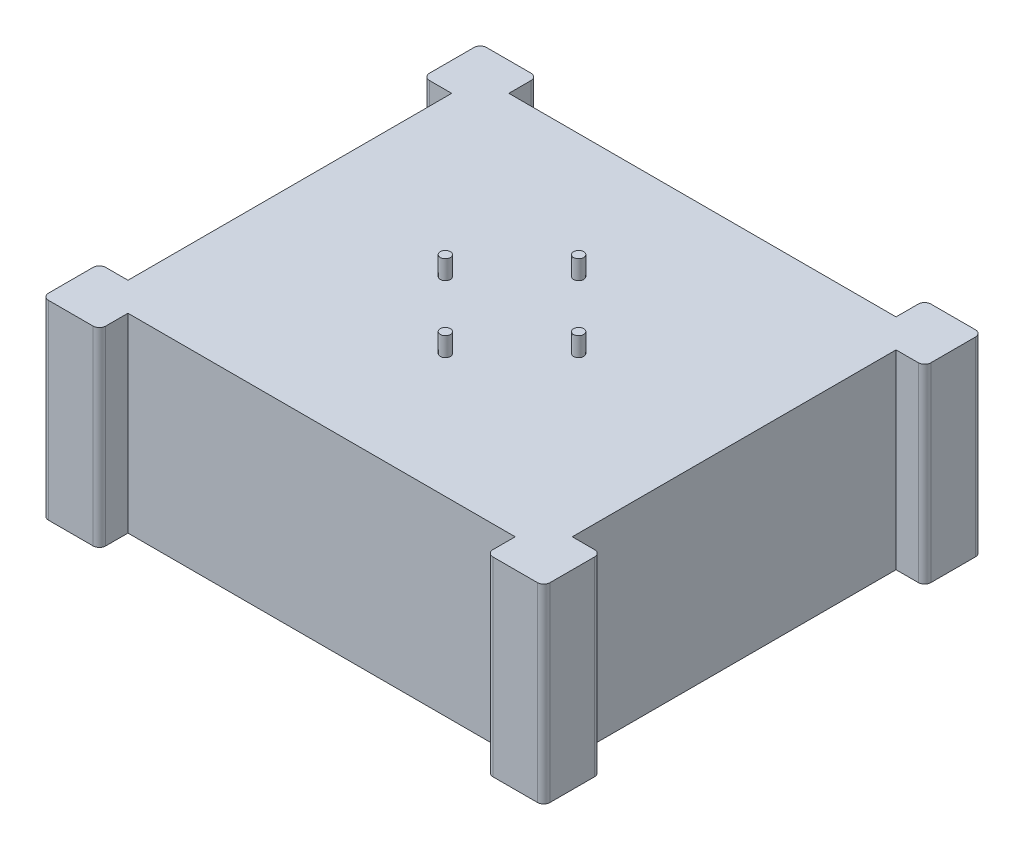
from build123d import *

# Parameters (mm, degrees)
SKETCH1_W           = 350
SKETCH1_H           = 300
BOSS_EXTRUDE1_DEPTH = 3
SKETCH1_3_R         = 4
BOSS_EXTRUDE2_DEPTH = 15
BOSS_EXTRUDE3_DEPTH = 150
CUT_EXTRUDE1_DEPTH  = 150


with BuildPart() as part:
    # Sketch1 → Boss-Extrude1 (new body)
    with BuildSketch(Plane(origin=(0, 0, 0), x_dir=(1, 0, 0), z_dir=(0, 1, 0))):
        Rectangle(SKETCH1_W, SKETCH1_H)
    extrude(amount=-BOSS_EXTRUDE1_DEPTH)

    # Sketch1<3> → Boss-Extrude2 (add)
    with BuildSketch(Plane(origin=(0, 0, 0), x_dir=(1, 0, 0), z_dir=(0, 1, 0))):
        with Locations((0, 52.5)):
            Circle(SKETCH1_3_R)
        with Locations((0, -52.5)):
            Circle(SKETCH1_3_R)
        with Locations((52.5, 0)):
            Circle(SKETCH1_3_R)
        with Locations((-52.5, 0)):
            Circle(SKETCH1_3_R)
    extrude(amount=BOSS_EXTRUDE2_DEPTH)

    # Sketch1<4> → Boss-Extrude3 (add)
    with BuildSketch(Plane(origin=(0, 0, 0), x_dir=(1, 0, 0), z_dir=(0, 1, 0))):
        with BuildLine():
            Line((-192.5, 127.5), (-175, 127.5))
            Line((-175, 127.5), (-175, -127.5))
            Line((-175, -127.5), (-192.5, -127.5))
            ThreePointArc((-192.5, -127.5), (-196.035533906, -128.964466094), (-197.5, -132.5))
            Line((-197.5, -132.5), (-197.5, -167.5))
            ThreePointArc((-197.5, -167.5), (-196.035533906, -171.035533906), (-192.5, -172.5))
            Line((-192.5, -172.5), (-157.5, -172.5))
            ThreePointArc((-157.5, -172.5), (-153.964466094, -171.035533906), (-152.5, -167.5))
            Line((-152.5, -167.5), (-152.5, -150))
            Line((-152.5, -150), (152.5, -150))
            Line((152.5, -150), (152.5, -167.5))
            ThreePointArc((152.5, -167.5), (153.964466094, -171.035533906), (157.5, -172.5))
            Line((157.5, -172.5), (192.5, -172.5))
            ThreePointArc((192.5, -172.5), (196.035533906, -171.035533906), (197.5, -167.5))
            Line((197.5, -167.5), (197.5, -132.5))
            ThreePointArc((197.5, -132.5), (196.035533906, -128.964466094), (192.5, -127.5))
            Line((192.5, -127.5), (175, -127.5))
            Line((175, -127.5), (175, 127.5))
            Line((175, 127.5), (192.5, 127.5))
            ThreePointArc((192.5, 127.5), (196.035533906, 128.964466094), (197.5, 132.5))
            Line((197.5, 132.5), (197.5, 167.5))
            ThreePointArc((197.5, 167.5), (196.035533906, 171.035533906), (192.5, 172.5))
            Line((192.5, 172.5), (157.5, 172.5))
            ThreePointArc((157.5, 172.5), (153.964466094, 171.035533906), (152.5, 167.5))
            Line((152.5, 167.5), (152.5, 150))
            Line((152.5, 150), (-152.5, 150))
            Line((-152.5, 150), (-152.5, 167.5))
            ThreePointArc((-152.5, 167.5), (-153.964466094, 171.035533906), (-157.5, 172.5))
            Line((-157.5, 172.5), (-192.5, 172.5))
            ThreePointArc((-192.5, 172.5), (-196.035533906, 171.035533906), (-197.5, 167.5))
            Line((-197.5, 167.5), (-197.5, 132.5))
            ThreePointArc((-197.5, 132.5), (-196.035533906, 128.964466094), (-192.5, 127.5))
        make_face()
        with BuildLine():
            Line((-170, -127.5), (-170, 127.5))
            Line((-170, 127.5), (-157.5, 127.5))
            ThreePointArc((-157.5, 127.5), (-153.964466094, 128.964466094), (-152.5, 132.5))
            Line((-152.5, 132.5), (-152.5, 145))
            Line((-152.5, 145), (152.5, 145))
            Line((152.5, 145), (152.5, 132.5))
            ThreePointArc((152.5, 132.5), (153.964466094, 128.964466094), (157.5, 127.5))
            Line((157.5, 127.5), (170, 127.5))
            Line((170, 127.5), (170, -127.5))
            Line((170, -127.5), (157.5, -127.5))
            ThreePointArc((157.5, -127.5), (153.964466094, -128.964466094), (152.5, -132.5))
            Line((152.5, -132.5), (152.5, -145))
            Line((152.5, -145), (-152.5, -145))
            Line((-152.5, -145), (-152.5, -132.5))
            ThreePointArc((-152.5, -132.5), (-153.964466094, -128.964466094), (-157.5, -127.5))
            Line((-157.5, -127.5), (-170, -127.5))
        make_face(mode=Mode.SUBTRACT)
    extrude(amount=-BOSS_EXTRUDE3_DEPTH)

    # Sketch3 → Cut-Extrude1 (cut)
    with BuildSketch(Plane.ZY.offset(175)):
        with BuildLine():
            ThreePointArc((-60.172318038, -44.772481883), (-74.423265007, -49.065117798), (-85.266270244, -59.260481944))
            Line((-85.266270244, -59.260481944), (-81.360570452, -61.515438771))
            ThreePointArc((-81.360570452, -61.515438771), (-72.173265007, -52.962232115), (-60.172318038, -49.282395536))
            Line((-60.172318038, -49.282395536), (-60.172318038, -44.772481883))
        make_face()
        with BuildLine():
            Line((-83.359623482, -64.977900186), (-87.265323275, -62.72294336))
            ThreePointArc((-87.265323275, -62.72294336), (-90.673265007, -77.210943421), (-87.265323275, -91.698943483))
            Line((-87.265323275, -91.698943483), (-83.359623482, -89.443986656))
            ThreePointArc((-83.359623482, -89.443986656), (-86.173265007, -77.210943421), (-83.359623482, -64.977900186))
        make_face()
        with BuildLine():
            ThreePointArc((-60.172318038, -52.290995849), (-70.673265007, -55.560308327), (-78.75504615, -63.019738928))
            Line((-78.75504615, -63.019738928), (-70.048241987, -68.046614655))
            ThreePointArc((-70.048241987, -68.046614655), (-65.673265007, -64.220562364), (-60.172318038, -62.344747304))
            Line((-60.172318038, -62.344747304), (-60.172318038, -52.290995849))
        make_face()
        with BuildLine():
            ThreePointArc((-31.080259771, -59.260481944), (-41.923265007, -49.065117798), (-56.174211977, -44.772481883))
            Line((-56.174211977, -44.772481883), (-56.174211977, -49.282395536))
            ThreePointArc((-56.174211977, -49.282395536), (-44.173265007, -52.962232115), (-34.985959563, -61.515438771))
            Line((-34.985959563, -61.515438771), (-31.080259771, -59.260481944))
        make_face()
        with BuildLine():
            Line((-72.047295017, -71.50907607), (-80.754099181, -66.482200343))
            ThreePointArc((-80.754099181, -66.482200343), (-83.173265007, -77.210943421), (-80.754099181, -87.939686499))
            Line((-80.754099181, -87.939686499), (-72.047295017, -82.912810772))
            ThreePointArc((-72.047295017, -82.912810772), (-73.173265007, -77.210943421), (-72.047295017, -71.50907607))
        make_face()
        with BuildLine():
            Line((-81.360570452, -92.906448072), (-85.266270244, -95.161404898))
            ThreePointArc((-85.266270244, -95.161404898), (-74.423265007, -105.356769044), (-60.172318038, -109.64940496))
            Line((-60.172318038, -109.64940496), (-60.172318038, -105.139491306))
            ThreePointArc((-60.172318038, -105.139491306), (-72.173265007, -101.459654727), (-81.360570452, -92.906448072))
        make_face()
        with BuildLine():
            ThreePointArc((-60.172318038, -65.378623827), (-64.173265007, -66.818638576), (-67.420827847, -69.563552916))
            Line((-67.420827847, -69.563552916), (-61.142723279, -73.188218278))
            ThreePointArc((-61.142723279, -73.188218278), (-60.673265007, -72.880816402), (-60.172318038, -72.627954551))
            Line((-60.172318038, -72.627954551), (-60.172318038, -65.378623827))
        make_face()
        with BuildLine():
            ThreePointArc((-37.591483864, -63.019738928), (-45.673265007, -55.560308327), (-56.174211977, -52.290995849))
            Line((-56.174211977, -52.290995849), (-56.174211977, -62.344747304))
            ThreePointArc((-56.174211977, -62.344747304), (-50.673265007, -64.220562364), (-46.298288028, -68.046614655))
            Line((-46.298288028, -68.046614655), (-37.591483864, -63.019738928))
        make_face()
        with BuildLine():
            ThreePointArc((-29.08120674, -91.698943483), (-25.673265007, -77.210943421), (-29.08120674, -62.72294336))
            Line((-29.08120674, -62.72294336), (-32.986906533, -64.977900186))
            ThreePointArc((-32.986906533, -64.977900186), (-30.173265007, -77.210943421), (-32.986906533, -89.443986656))
            Line((-32.986906533, -89.443986656), (-29.08120674, -91.698943483))
        make_face()
        with BuildLine():
            Line((-63.141776309, -76.650679694), (-69.419880877, -73.026014332))
            ThreePointArc((-69.419880877, -73.026014332), (-70.173265007, -77.210943421), (-69.419880877, -81.395872511))
            Line((-69.419880877, -81.395872511), (-63.141776309, -77.771207148))
            ThreePointArc((-63.141776309, -77.771207148), (-63.173265007, -77.210943421), (-63.141776309, -76.650679694))
        make_face()
        with BuildLine():
            Line((-70.048241987, -86.375272187), (-78.75504615, -91.402147915))
            ThreePointArc((-78.75504615, -91.402147915), (-70.673265007, -98.861578516), (-60.172318038, -102.130890993))
            Line((-60.172318038, -102.130890993), (-60.172318038, -92.077139538))
            ThreePointArc((-60.172318038, -92.077139538), (-65.673265007, -90.201324478), (-70.048241987, -86.375272187))
        make_face()
        with BuildLine():
            Line((-56.174211977, -105.139491306), (-56.174211977, -109.64940496))
            ThreePointArc((-56.174211977, -109.64940496), (-41.923265007, -105.356769044), (-31.080259771, -95.161404898))
            Line((-31.080259771, -95.161404898), (-34.985959563, -92.906448072))
            ThreePointArc((-34.985959563, -92.906448072), (-44.173265007, -101.459654727), (-56.174211977, -105.139491306))
        make_face()
        with BuildLine():
            ThreePointArc((-48.925702168, -69.563552916), (-52.173265007, -66.818638576), (-56.174211977, -65.378623827))
            Line((-56.174211977, -65.378623827), (-56.174211977, -72.627954551))
            ThreePointArc((-56.174211977, -72.627954551), (-55.673265007, -72.880816402), (-55.203806736, -73.188218278))
            Line((-55.203806736, -73.188218278), (-48.925702168, -69.563552916))
        make_face()
        with BuildLine():
            ThreePointArc((-35.592430834, -87.939686499), (-33.173265007, -77.210943421), (-35.592430834, -66.482200343))
            Line((-35.592430834, -66.482200343), (-44.299234997, -71.50907607))
            ThreePointArc((-44.299234997, -71.50907607), (-43.173265007, -77.210943421), (-44.299234997, -82.912810772))
            Line((-44.299234997, -82.912810772), (-35.592430834, -87.939686499))
        make_face()
        with BuildLine():
            Line((-61.142723279, -81.233668564), (-67.420827847, -84.858333926))
            ThreePointArc((-67.420827847, -84.858333926), (-64.173265007, -87.603248267), (-60.172318038, -89.043263015))
            Line((-60.172318038, -89.043263015), (-60.172318038, -81.793932291))
            ThreePointArc((-60.172318038, -81.793932291), (-60.673265007, -81.54107044), (-61.142723279, -81.233668564))
        make_face()
        with BuildLine():
            Line((-56.174211977, -92.077139538), (-56.174211977, -102.130890993))
            ThreePointArc((-56.174211977, -102.130890993), (-45.673265007, -98.861578516), (-37.591483864, -91.402147915))
            Line((-37.591483864, -91.402147915), (-46.298288028, -86.375272187))
            ThreePointArc((-46.298288028, -86.375272187), (-50.673265007, -90.201324478), (-56.174211977, -92.077139538))
        make_face()
        with BuildLine():
            ThreePointArc((-46.926649138, -81.395872511), (-46.173265007, -77.210943421), (-46.926649138, -73.026014332))
            Line((-46.926649138, -73.026014332), (-53.204753706, -76.650679694))
            ThreePointArc((-53.204753706, -76.650679694), (-53.173265007, -77.210943421), (-53.204753706, -77.771207148))
            Line((-53.204753706, -77.771207148), (-46.926649138, -81.395872511))
        make_face()
        with BuildLine():
            Line((-56.174211977, -81.793932291), (-56.174211977, -89.043263015))
            ThreePointArc((-56.174211977, -89.043263015), (-52.173265007, -87.603248267), (-48.925702168, -84.858333926))
            Line((-48.925702168, -84.858333926), (-55.203806736, -81.233668564))
            ThreePointArc((-55.203806736, -81.233668564), (-55.673265007, -81.54107044), (-56.174211977, -81.793932291))
        make_face()
    extrude(amount=-CUT_EXTRUDE1_DEPTH, mode=Mode.SUBTRACT)


solid = part.part
